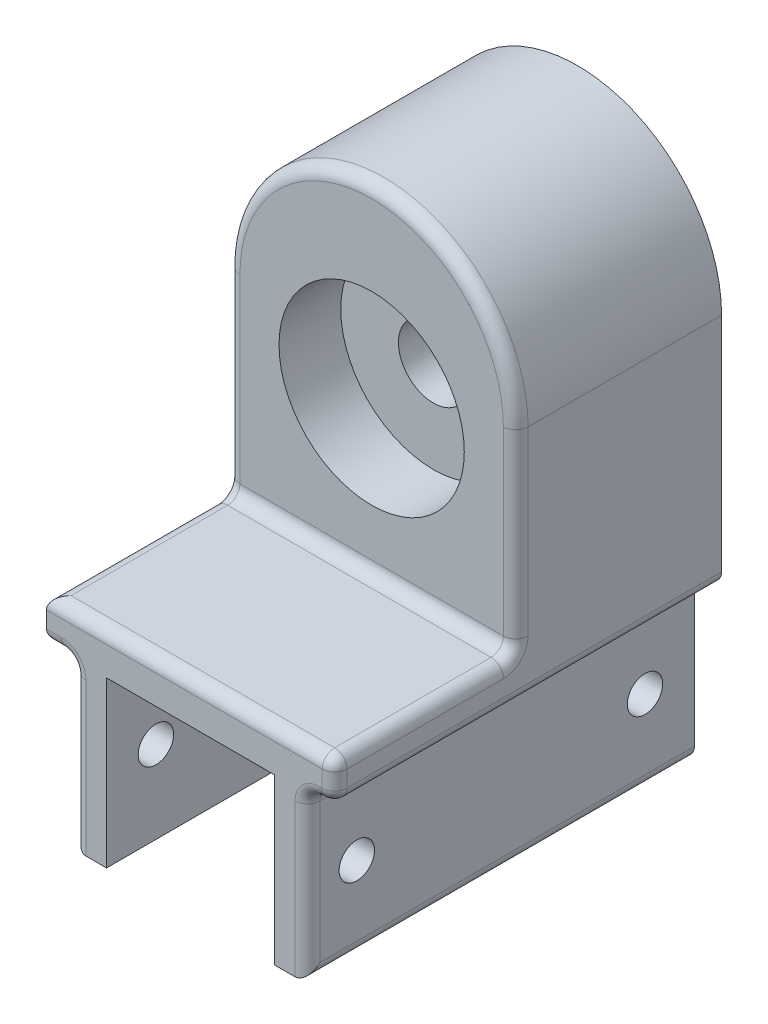
from build123d import *

# Parameters (mm, degrees)
SKETCH1_W           = 35
SKETCH1_H           = 28.5
BOSS_EXTRUDE1_DEPTH = 25
SKETCH2_R           = 4.25
CUT_EXTRUDE1_DEPTH  = 20
SKETCH3_R           = 11.25
CUT_EXTRUDE2_DEPTH  = 7.5
SKETCH9_W           = 35
SKETCH9_H           = 5
BOSS_EXTRUDE4_DEPTH = 22
SKETCH4_W           = 4
SKETCH4_H           = 47
BOSS_EXTRUDE2_DEPTH = 20
FILLET1_R           = 1.5
CUT_EXTRUDE3_REACH  = 66.415
SKETCH6_R           = 2.15
MIRROR1_START       = -14.2
MIRROR1_OUTLINE_W   = 20
MIRROR1_OUTLINE_H   = 47
MIRROR1_OUTLINE_R   = 2.15
MIRROR1_DEPTH       = 4
MIRROR1_2_DEPTH     = 47
FILLET2_R           = 1.5


with BuildPart() as part:
    # Sketch1 → Boss-Extrude1 (new body)
    with BuildSketch(Plane.XY):
        with BuildLine():
            ThreePointArc((-17.5, 14.25), (0, 31.75), (17.5, 14.25))
            Line((17.5, 14.25), (-17.5, 14.25))
        make_face()
        Rectangle(SKETCH1_W, SKETCH1_H)
    extrude(amount=BOSS_EXTRUDE1_DEPTH)

    # Sketch2 → Cut-Extrude1 (cut)
    with BuildSketch(Plane.XY.offset(25)):
        with Locations((0, 9.25)):
            Circle(SKETCH2_R)
    extrude(amount=-CUT_EXTRUDE1_DEPTH, mode=Mode.SUBTRACT)

    # Sketch3 → Cut-Extrude2 (cut)
    with BuildSketch(Plane.XY.offset(25)):
        with Locations((0, 9.25)):
            Circle(SKETCH3_R)
    extrude(amount=-CUT_EXTRUDE2_DEPTH, mode=Mode.SUBTRACT)

    # Sketch9 → Boss-Extrude4 (add)
    with BuildSketch(Plane.XY.offset(25)):
        with Locations((0, -11.75)):
            Rectangle(SKETCH9_W, SKETCH9_H)
    extrude(amount=BOSS_EXTRUDE4_DEPTH)

    # Sketch4 → Boss-Extrude2 (add)
    with BuildSketch(Plane.XZ.offset(14.25)):
        with Locations((12.2, 23.5)):
            Rectangle(SKETCH4_W, SKETCH4_H)
    extrude(amount=BOSS_EXTRUDE2_DEPTH)

    # Fillet1
    fillet1_edges = [part.edges().sort_by_distance(p)[0] for p in [
        (14.2, -14.25, 23.5),
        (17.5, -14.25, 23.5),
    ]]
    fillet(fillet1_edges, radius=FILLET1_R)

    # Sketch6 → Cut-Extrude3 (cut, up to next)
    with BuildSketch(Plane.ZY.offset(-10.2), mode=Mode.PRIVATE) as cut_extrude3_sk1:
        with Locations(Location((6, -24.25, 0), (0, 0, 270))):
            Circle(SKETCH6_R)
    cut_extrude3_tool1 = extrude(cut_extrude3_sk1.sketch, amount=-CUT_EXTRUDE3_REACH, mode=Mode.PRIVATE) & part.part
    # Sketch6 → Cut-Extrude3 (cut, up to next)
    with BuildSketch(Plane.ZY.offset(-10.2), mode=Mode.PRIVATE) as cut_extrude3_sk2:
        with Locations(Location((41, -24.25, 0), (0, 0, 270))):
            Circle(SKETCH6_R)
    cut_extrude3_tool2 = extrude(cut_extrude3_sk2.sketch, amount=-CUT_EXTRUDE3_REACH, mode=Mode.PRIVATE) & part.part
    add(cut_extrude3_tool1.solids().sort_by_distance((10.2, -24.25, 6))[0], mode=Mode.SUBTRACT)
    add(cut_extrude3_tool2.solids().sort_by_distance((10.2, -24.25, 41))[0], mode=Mode.SUBTRACT)

    # Mirror1: read off the stored shape, not the designer's step
    # Mirror1 outline → Mirror1 (add)
    with BuildSketch(Plane.YZ.offset(MIRROR1_START)):
        with Locations((-24.25, 23.5)):
            Rectangle(MIRROR1_OUTLINE_W, MIRROR1_OUTLINE_H)
        with Locations((-24.25, 6)):
            Circle(MIRROR1_OUTLINE_R, mode=Mode.SUBTRACT)
        with Locations((-24.25, 41)):
            Circle(MIRROR1_OUTLINE_R, mode=Mode.SUBTRACT)
    extrude(amount=MIRROR1_DEPTH)

    # Mirror1 2 outline → Mirror1 2 (add)
    with BuildSketch(Plane.XY):
        with BuildLine():
            Line((-14.2, -14.25), (-15.7, -14.25))
            ThreePointArc((-15.7, -14.25), (-14.639339828, -14.689339828), (-14.2, -15.75))
            Line((-14.2, -15.75), (-14.2, -14.25))
        make_face()
    extrude(amount=MIRROR1_2_DEPTH)

    # Fillet2
    fillet2_edges = [part.edges().sort_by_distance(p)[0] for p in [
        (-17.5, 2.5, 25),
        (17.5, 2.5, 25),
        (-17.5, -9.25, 36),
        (0, -9.25, 25),
        (17.5, -9.25, 36),
        (-16.6, -14.25, 47),
        (0, -9.25, 47),
        (14.2, -25, 47),
        (14.2, -34.25, 23.5),
        (0, 31.75, 25),
        (17.5, -11, 47),
        (15.85, -14.25, 47),
        (17.060660172, -13.810660172, 47),
        (14.639339828, -14.689339828, 47),
        (-14.2, -34.25, 23.5),
        (-14.2, -25, 47),
        (-14.639339828, -14.689339828, 47),
        (-17.5, -14.25, 23.5),
    ]]
    fillet(fillet2_edges, radius=FILLET2_R)


solid = part.part
